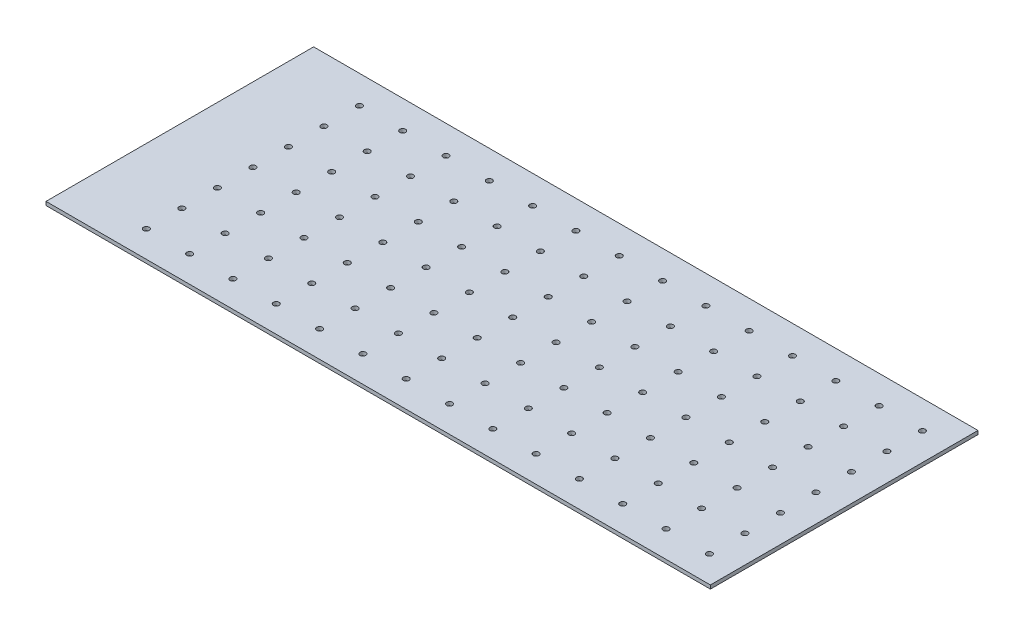
from build123d import *

# Parameters (mm, degrees)
SKETCH1_W            = 540
SKETCH1_H            = 233.64
BOSS_EXTRUDE1_DEPTH  = 3.18
CUT_EXTRUDE1_REACH   = 296.206
SKETCH2_R            = 2.5
LPATTERN1_COUNT      = 14
LPATTERN1_PITCH      = 37.81
LPATTERN1_COUNT_DIR2 = 7
LPATTERN1_PITCH_DIR2 = 31
SKETCH4_W            = 233.64
SKETCH4_H            = 3.18
BOSS_EXTRUDE2_DEPTH  = 40


with BuildPart() as part:
    # Sketch1 → Boss-Extrude1 (new body)
    with BuildSketch(Plane(origin=(0, 0, 0), x_dir=(1, 0, 0), z_dir=(0, 1, 0))):
        Rectangle(SKETCH1_W, SKETCH1_H)
    extrude(amount=BOSS_EXTRUDE1_DEPTH)

    # Sketch2 → Cut-Extrude1 (cut, up to next)
    with BuildSketch(Plane(origin=(0, 3.18, 0), x_dir=(1, 0, 0), z_dir=(0, 1, 0)), mode=Mode.PRIVATE) as cut_extrude1_sk1:
        with Locations((-245.45, 92.22)):
            Circle(SKETCH2_R)
    cut_extrude1_tool1 = extrude(cut_extrude1_sk1.sketch, amount=-CUT_EXTRUDE1_REACH, mode=Mode.PRIVATE) & part.part
    cut_extrude1 = cut_extrude1_tool1.solids().sort_by_distance((-245.45, 3.18, -92.22))[0]
    add(cut_extrude1, mode=Mode.SUBTRACT)

    # LPattern1: Cut-Extrude1 14 × 7
    with Locations(*[(i * LPATTERN1_PITCH, 0, j * LPATTERN1_PITCH_DIR2) for i in range(LPATTERN1_COUNT) for j in range(LPATTERN1_COUNT_DIR2) if (i, j) != (0, 0)]):
        add(cut_extrude1, mode=Mode.SUBTRACT)

    # Sketch4 → Boss-Extrude2 (add)
    with BuildSketch(Plane.ZY.offset(270)):
        with Locations((0, 1.59)):
            Rectangle(SKETCH4_W, SKETCH4_H)
    extrude(amount=BOSS_EXTRUDE2_DEPTH)


solid = part.part
